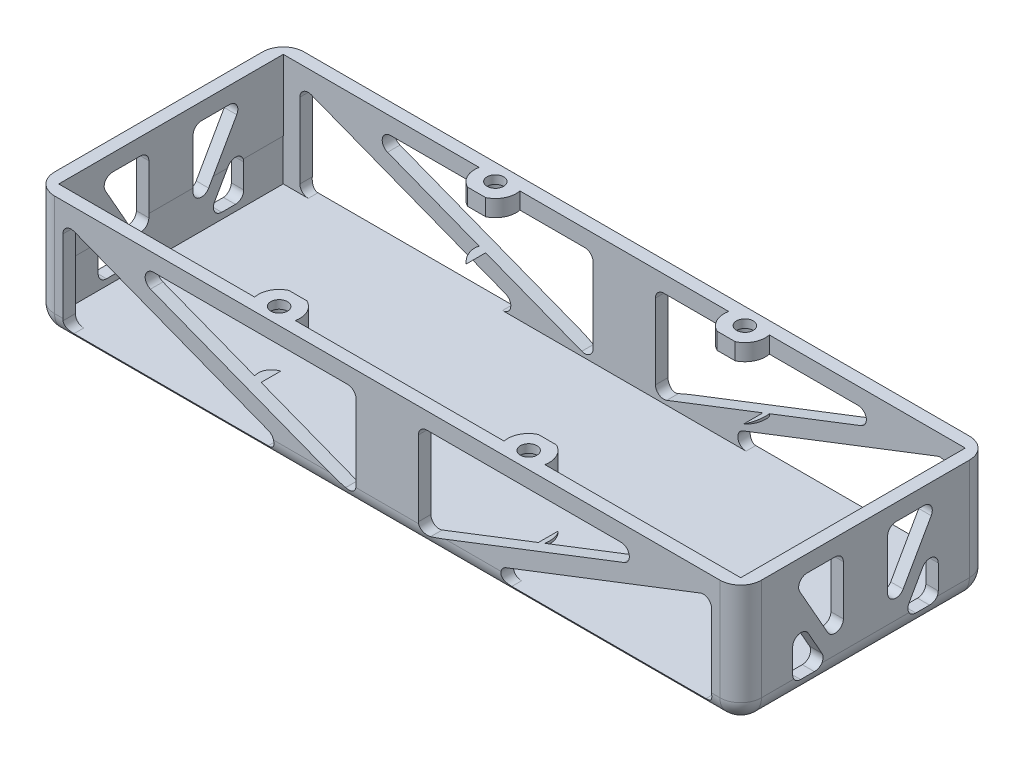
from build123d import *

# Parameters (mm, degrees)
SKETCH_1_W               = 170
SKETCH_1_H               = 60
EXTRUDE_1_DEPTH          = 2.5
EXTRUDE_3_DEPTH          = 27
CUT_EXTRUDE_3_DEPTH      = 104.670149995
CUT_EXTRUDE_3_DEPTH_BACK = 104.670149995
CUT_EXTRUDE_4_DEPTH      = 173.218611073
CUT_EXTRUDE_4_DEPTH_BACK = 173.218611073
FILLET_2_R               = 2
SKETCH_15_R              = 2
CUT_EXTRUDE_5_DEPTH      = 94.676304368
FILLET_3_R               = 5
CUT_EXTRUDE_6_REACH      = 96.843
SKETCH_17_R              = 3.55
CUT_EXTRUDE_7_DEPTH      = 2
SKETCH_18_W              = 164.017567796
SKETCH_18_H              = 54
CUT_EXTRUDE_8_DEPTH      = 10


with BuildPart() as part:
    # 草圖1 → 填料-伸長1 (new body)
    with BuildSketch(Plane(origin=(0, 0, 0), x_dir=(1, 0, 0), z_dir=(0, 1, 0))):
        Rectangle(SKETCH_1_W, SKETCH_1_H)
    extrude(amount=EXTRUDE_1_DEPTH)

    # 草圖3 → 填料-伸長3 (add)
    with BuildSketch(Plane(origin=(0, 2.5, 0), x_dir=(1, 0, 0), z_dir=(0, 1, 0))):
        Polygon((-85, -30), (-20, -30), (20, -30), (85, -30), (85, 0), (85, 30), (20, 30), (-20, 30), (-85, 30), (-85, 0), align=None)
        Polygon((-20, -21.5), (-82, -21.5), (-82, 0), (-82, 21.5), (-20, 21.5), (20, 21.5), (82, 21.5), (82, 0), (82, -21.5), (20, -21.5), align=None, mode=Mode.SUBTRACT)
    extrude(amount=EXTRUDE_3_DEPTH)

    # 草圖6 → 除料-伸長3 (cut, two sides: drawn at the far end of the back side and taken through both)
    with BuildSketch(Plane.XY.offset(-21.5).offset(-CUT_EXTRUDE_3_DEPTH_BACK)):
        Polygon((-66.919093049, 25.5), (-7.5, 25.5), (-7.5, 2.5), align=None)
        Polygon((-78, 25.5), (-78, 2.5), (-18.580906951, 2.5), align=None)
        Polygon((7.5, 25.5), (7.5, 2.5), (66.919093049, 25.5), align=None)
        Polygon((78, 2.5), (18.580906951, 2.5), (78, 25.5), align=None)
    extrude(amount=CUT_EXTRUDE_3_DEPTH + CUT_EXTRUDE_3_DEPTH_BACK, mode=Mode.SUBTRACT)

    # 草圖7 → 除料-伸長4 (cut, two sides: drawn at the far end of the back side and taken through both)
    with BuildSketch(Plane.ZY.offset(-82).offset(-CUT_EXTRUDE_4_DEPTH_BACK)):
        Polygon((17.5, 25.5), (5.321878443, 4), (5.321878443, 25.5), align=None)
        Polygon((-5.321878443, 4), (-5.321878443, 25.5), (-17.5, 25.5), align=None)
        Polygon((17.5, 4), (8.7697079, 4), (17.5, 19.41299118), align=None)
        Polygon((-17.5, 19.41299118), (-17.5, 4), (-8.7697079, 4), align=None)
    extrude(amount=CUT_EXTRUDE_4_DEPTH + CUT_EXTRUDE_4_DEPTH_BACK, mode=Mode.SUBTRACT)

    # 圓角2
    fillet_2_edges = [part.edges().sort_by_distance(p)[0] for p in [
        (78, 2.5, 25.75),
        (78, 25.5, 25.75),
        (18.580906951, 2.5, 25.75),
        (78, 25.5, -25.75),
        (78, 2.5, -25.75),
        (18.580906951, 2.5, -25.75),
        (-18.580906951, 2.5, 25.75),
        (-78, 2.5, 25.75),
        (-78, 25.5, 25.75),
        (-18.580906951, 2.5, -25.75),
        (-78, 2.5, -25.75),
        (-78, 25.5, -25.75),
        (83.5, 19.41299118, -17.5),
        (83.5, 4, -8.7697079),
        (83.5, 4, -17.5),
        (-83.5, 19.41299118, -17.5),
        (-83.5, 4, -8.7697079),
        (-83.5, 4, -17.5),
        (83.5, 25.5, 5.321878443),
        (83.5, 25.5, 17.5),
        (83.5, 4, 5.321878443),
        (-83.5, 25.5, 5.321878443),
        (-83.5, 25.5, 17.5),
        (-83.5, 4, 5.321878443),
        (83.5, 19.41299118, 17.5),
        (83.5, 4, 17.5),
        (83.5, 4, 8.7697079),
        (-83.5, 19.41299118, 17.5),
        (-83.5, 4, 17.5),
        (-83.5, 4, 8.7697079),
        (83.5, 4, -5.321878443),
        (83.5, 25.5, -17.5),
        (83.5, 25.5, -5.321878443),
        (-83.5, 4, -5.321878443),
        (-83.5, 25.5, -17.5),
        (-83.5, 25.5, -5.321878443),
        (-66.919093049, 25.5, 25.75),
        (-7.5, 25.5, 25.75),
        (-7.5, 2.5, 25.75),
        (-7.5, 25.5, -25.75),
        (-7.5, 2.5, -25.75),
        (-66.919093049, 25.5, -25.75),
        (7.5, 25.5, 25.75),
        (66.919093049, 25.5, 25.75),
        (7.5, 2.5, 25.75),
        (7.5, 25.5, -25.75),
        (66.919093049, 25.5, -25.75),
        (7.5, 2.5, -25.75),
    ]]
    fillet(fillet_2_edges, radius=FILLET_2_R)

    # 草圖15 → 除料-伸長5 (cut, through all)
    with BuildSketch(Plane.XZ.offset(-25.5)):
        with Locations((30, 26)):
            Circle(SKETCH_15_R)
        with Locations(Location((-30, 26, 0), (0, 0, 180))):
            Circle(SKETCH_15_R)
        with Locations(Location((30, -26, 0), (0, 0, 180))):
            Circle(SKETCH_15_R)
        with Locations((-30, -26)):
            Circle(SKETCH_15_R)
    extrude(amount=-CUT_EXTRUDE_5_DEPTH, mode=Mode.SUBTRACT)

    # 圓角3
    # the kernel refuses this fillet: 5 mm, written as the material it takes off along each edge
    with BuildSketch(Plane(origin=(-80, 5, 25), x_dir=(0, -1, 0), z_dir=(-1, 0, 0))) as fillet_3_piece_1_section:
        Polygon((0, 0), (FILLET_3_R, 0), (FILLET_3_R, FILLET_3_R), (0, FILLET_3_R), align=None)
    fillet_3_piece_1 = extrude(amount=FILLET_3_R, mode=Mode.PRIVATE)
    fillet_3_piece_1 = fillet_3_piece_1 - Plane(origin=(-80, 5, 25), x_dir=(0, 0.7071067811865475, -0.7071067811865475), z_dir=(-1, 0, 0)) * Sphere(FILLET_3_R, mode=Mode.PRIVATE)
    add(fillet_3_piece_1, mode=Mode.SUBTRACT)
    with BuildSketch(Plane(origin=(-80, 5, -25), x_dir=(0, -1, 0), z_dir=(-1, 0, 0))) as fillet_3_piece_2_section:
        Polygon((0, 0), (FILLET_3_R, 0), (FILLET_3_R, -FILLET_3_R), (0, -FILLET_3_R), align=None)
    fillet_3_piece_2 = extrude(amount=FILLET_3_R, mode=Mode.PRIVATE)
    fillet_3_piece_2 = fillet_3_piece_2 - Plane(origin=(-80, 5, -25), x_dir=(0, 0.7071067811865475, 0.7071067811865475), z_dir=(-1, 0, 0)) * Sphere(FILLET_3_R, mode=Mode.PRIVATE)
    add(fillet_3_piece_2, mode=Mode.SUBTRACT)
    with BuildSketch(Plane(origin=(80, 5, -25), x_dir=(0, 0, -1), z_dir=(0, -1, 0))) as fillet_3_piece_3_section:
        Polygon((0, 0), (FILLET_3_R, 0), (FILLET_3_R, FILLET_3_R), (0, FILLET_3_R), align=None)
    fillet_3_piece_3 = extrude(amount=FILLET_3_R, mode=Mode.PRIVATE)
    fillet_3_piece_3 = fillet_3_piece_3 - Plane(origin=(80, 5, -25), x_dir=(-0.7071067811865475, 0, 0.7071067811865475), z_dir=(0, -1, 0)) * Sphere(FILLET_3_R, mode=Mode.PRIVATE)
    add(fillet_3_piece_3, mode=Mode.SUBTRACT)
    with BuildSketch(Plane(origin=(80, 5, 25), x_dir=(1, 0, 0), z_dir=(0, -1, 0))) as fillet_3_piece_4_section:
        Polygon((0, 0), (FILLET_3_R, 0), (FILLET_3_R, FILLET_3_R), (0, FILLET_3_R), align=None)
    fillet_3_piece_4 = extrude(amount=FILLET_3_R, mode=Mode.PRIVATE)
    fillet_3_piece_4 = fillet_3_piece_4 - Plane(origin=(80, 5, 25), x_dir=(-0.7071067811865475, 0, -0.7071067811865475), z_dir=(0, -1, 0)) * Sphere(FILLET_3_R, mode=Mode.PRIVATE)
    add(fillet_3_piece_4, mode=Mode.SUBTRACT)
    with BuildSketch(Plane(origin=(-85, 0, 25), x_dir=(0, 1, 0), z_dir=(0, 0, -1))) as fillet_3_piece_5:
        with BuildLine():
            CenterArc((FILLET_3_R, FILLET_3_R), FILLET_3_R, 180, 90)
            Line((0, FILLET_3_R), (0, 0))
            Line((0, 0), (FILLET_3_R, 0))
        make_face()
    extrude(amount=50, mode=Mode.SUBTRACT)
    with BuildSketch(Plane(origin=(85, 0, -25), x_dir=(-1, 0, 0), z_dir=(0, 0, 1))) as fillet_3_piece_6:
        with BuildLine():
            CenterArc((FILLET_3_R, -FILLET_3_R), FILLET_3_R, 90, 90)
            Line((0, -FILLET_3_R), (0, 0))
            Line((0, 0), (FILLET_3_R, 0))
        make_face()
    extrude(amount=50, mode=Mode.SUBTRACT)
    with BuildSketch(Plane(origin=(80, 0, 30), x_dir=(0, 1, 0), z_dir=(-1, 0, 0))) as fillet_3_piece_7:
        with BuildLine():
            CenterArc((FILLET_3_R, FILLET_3_R), FILLET_3_R, 180, 90)
            Line((0, FILLET_3_R), (0, 0))
            Line((0, 0), (FILLET_3_R, 0))
        make_face()
    extrude(amount=160, mode=Mode.SUBTRACT)
    with BuildSketch(Plane(origin=(-80, 0, -30), x_dir=(0, 0, 1), z_dir=(1, 0, 0))) as fillet_3_piece_8:
        with BuildLine():
            CenterArc((FILLET_3_R, -FILLET_3_R), FILLET_3_R, 90, 90)
            Line((0, -FILLET_3_R), (0, 0))
            Line((0, 0), (FILLET_3_R, 0))
        make_face()
    extrude(amount=160, mode=Mode.SUBTRACT)
    with BuildSketch(Plane(origin=(-85, 5, 30), x_dir=(0, 0, -1), z_dir=(0, 1, 0)), Plane(origin=(85, 5, 30), x_dir=(-1, 0, 0), z_dir=(0, 1, 0)), Plane(origin=(85, 42, -30), x_dir=(-1, 0, 0), z_dir=(0, -1, 0)), Plane(origin=(-85, 42, -30), x_dir=(0, 0, 1), z_dir=(0, -1, 0))) as fillet_3_piece_9:
        with BuildLine():
            CenterArc((FILLET_3_R, -FILLET_3_R), FILLET_3_R, 90, 90)
            Line((0, -FILLET_3_R), (0, 0))
            Line((0, 0), (FILLET_3_R, 0))
        make_face()
    extrude(amount=37, mode=Mode.SUBTRACT)

    # 除料-伸長6: up to this face of the body (flat: up to its plane)
    cut_extrude_6_end = Plane(part.part.faces().sort_by_distance((0, 2.5, 0))[0])
    # 草圖16 → 除料-伸長6 (cut, up to the picked face)
    with BuildSketch(Plane(origin=(0, 29.5, 0), x_dir=(1, 0, 0), z_dir=(0, 1, 0)), mode=Mode.PRIVATE) as cut_extrude_6_sk1:
        with BuildLine():
            Line((-34.898979486, 27), (-82, 27))
            Line((-82, 27), (-82, -27))
            Line((-82, -27), (-34.898979486, -27))
            ThreePointArc((-34.898979486, -27), (-30, -21), (-25.101020514, -27))
            Line((-25.101020514, -27), (25.101020514, -27))
            ThreePointArc((25.101020514, -27), (30, -21), (34.898979486, -27))
            Line((34.898979486, -27), (82, -27))
            Line((82, -27), (82, 27))
            Line((82, 27), (34.898979486, 27))
            ThreePointArc((34.898979486, 27), (30, 21), (25.101020514, 27))
            Line((25.101020514, 27), (-25.101020514, 27))
            ThreePointArc((-25.101020514, 27), (-30, 21), (-34.898979486, 27))
        make_face()
    cut_extrude_6_tool1 = split(extrude(cut_extrude_6_sk1.sketch, amount=-CUT_EXTRUDE_6_REACH, mode=Mode.PRIVATE), bisect_by=cut_extrude_6_end, keep=Keep.BOTH, mode=Mode.PRIVATE)
    add(cut_extrude_6_tool1.solids().sort_by(Axis((0, 29.5, 0), (0, -1, 0)))[0], mode=Mode.SUBTRACT)

    # 草圖17 → 除料-伸長7 (cut)
    with BuildSketch(Plane.XZ.offset(-25.5)):
        with Locations((-30, 26)):
            Circle(SKETCH_17_R)
        with Locations(Location((30, 26, 0), (0, 0, 180))):
            Circle(SKETCH_17_R)
        with Locations((30, -26)):
            Circle(SKETCH_17_R)
        with Locations(Location((-30, -26, 0), (0, 0, 180))):
            Circle(SKETCH_17_R)
    extrude(amount=-CUT_EXTRUDE_7_DEPTH, mode=Mode.SUBTRACT)

    # 草圖18 → 除料-伸長8 (cut)
    with BuildSketch(Plane(origin=(0, 2.5, 0), x_dir=(1, 0, 0), z_dir=(0, 1, 0))):
        Rectangle(SKETCH_18_W, SKETCH_18_H)
    extrude(amount=CUT_EXTRUDE_8_DEPTH, mode=Mode.SUBTRACT)


solid = part.part
